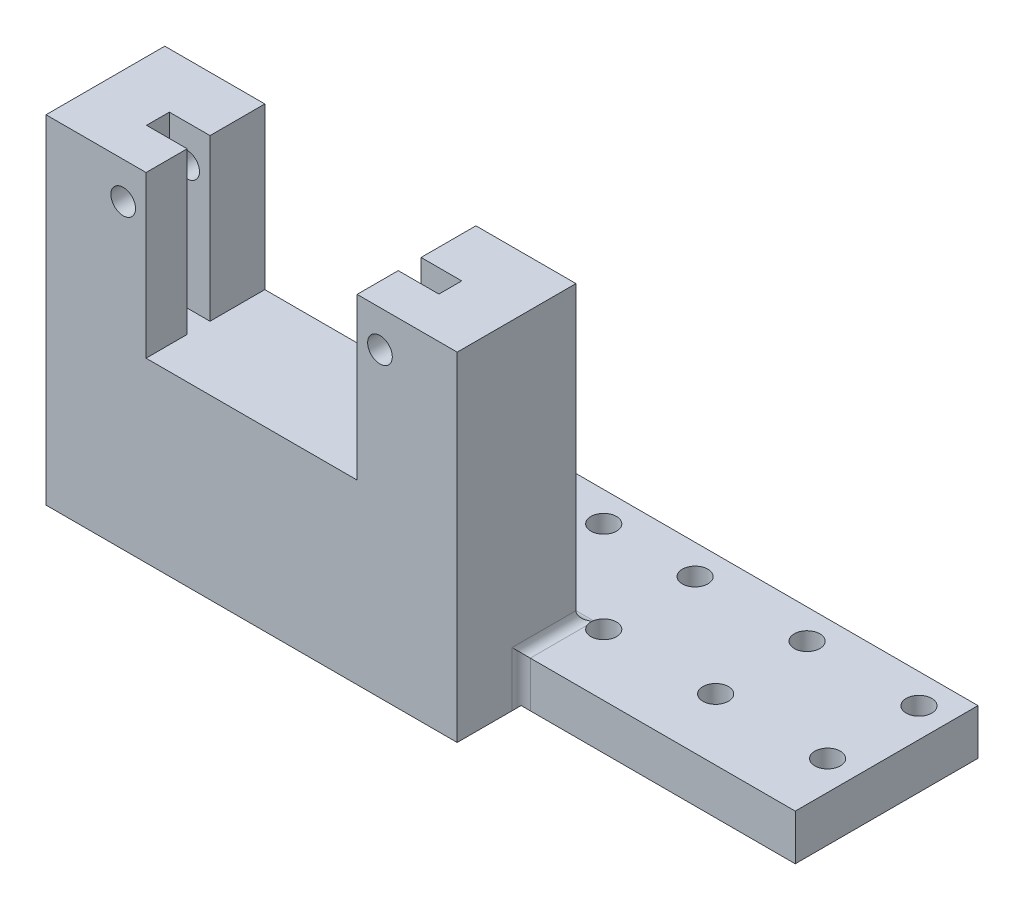
from build123d import *

# Parameters (mm, degrees)
SKETCH1_W           = 45
SKETCH1_H           = 6
BOSS_EXTRUDE1_DEPTH = 32
SKETCH2_W           = 23.1
SKETCH2_H           = 17.6
CUT_EXTRUDE1_DEPTH  = 56.542776308
SKETCH3_W           = 45
SKETCH3_H           = 20
BOSS_EXTRUDE2_DEPTH = 6
SKETCH4_W           = 20
SKETCH4_H           = 6
BOSS_EXTRUDE3_DEPTH = 30
SKETCH5_R           = 1.4
CUT_EXTRUDE2_DEPTH  = 87.423376467
BOSS_EXTRUDE4_DEPTH = 7
SKETCH7_W           = 32
SKETCH7_H           = 2.5
CUT_EXTRUDE3_DEPTH  = 17.6
SKETCH8_R           = 1.35
CUT_EXTRUDE4_DEPTH  = 86.895285086
CHAMFER1_SIZE       = 1
FILLET1_R           = 1


with BuildPart() as part:
    # Sketch1 → Boss-Extrude1 (new body)
    with BuildSketch(Plane(origin=(0, 0, 0), x_dir=(1, 0, 0), z_dir=(0, 1, 0))):
        with Locations((22.5, 3)):
            Rectangle(SKETCH1_W, SKETCH1_H)
    extrude(amount=BOSS_EXTRUDE1_DEPTH)

    # Sketch2 → Cut-Extrude1 (cut, through all)
    with BuildSketch(Plane.XY):
        with Locations((22.5, 23.2)):
            Rectangle(SKETCH2_W, SKETCH2_H)
    extrude(amount=-CUT_EXTRUDE1_DEPTH, mode=Mode.SUBTRACT)

    # Sketch3 → Boss-Extrude2 (add)
    with BuildSketch(Plane.XZ):
        with Locations((22.5, -10)):
            Rectangle(SKETCH3_W, SKETCH3_H)
    extrude(amount=BOSS_EXTRUDE2_DEPTH)

    # Sketch4 → Boss-Extrude3 (add)
    with BuildSketch(Plane(origin=(45, 0, 0), x_dir=(0, 0, -1), z_dir=(1, 0, 0))):
        with Locations((10, -3)):
            Rectangle(SKETCH4_W, SKETCH4_H)
    extrude(amount=BOSS_EXTRUDE3_DEPTH)

    # Sketch5 → Cut-Extrude2 (cut, through all)
    with BuildSketch(Plane.XZ.offset(6)):
        with Locations(Location((37.288839919, -16.75, 0), (0, 0, 270))):
            Circle(SKETCH5_R)
        with Locations(Location((47.288839919, -16.75, 0), (0, 0, 270))):
            Circle(SKETCH5_R)
        with Locations(Location((47.288839919, -6.75, 0), (0, 0, 270))):
            Circle(SKETCH5_R)
        with Locations(Location((59.538839919, -16.75, 0), (0, 0, 270))):
            Circle(SKETCH5_R)
        with Locations(Location((71.788839919, -16.75, 0), (0, 0, 270))):
            Circle(SKETCH5_R)
        with Locations(Location((71.788839919, -6.75, 0), (0, 0, 270))):
            Circle(SKETCH5_R)
        with Locations(Location((59.538839919, -6.75, 0), (0, 0, 270))):
            Circle(SKETCH5_R)
    extrude(amount=-CUT_EXTRUDE2_DEPTH, mode=Mode.SUBTRACT)

    # Sketch6 → Boss-Extrude4 (add)
    with BuildSketch(Plane.XY):
        Polygon((0, 32), (0, -6), (45, -6), (45, 0), (45, 32), (34.05, 32), (34.05, 14.4), (10.95, 14.4), (10.95, 32), align=None)
    extrude(amount=BOSS_EXTRUDE4_DEPTH)

    # Sketch7 → Cut-Extrude3 (cut)
    with BuildSketch(Plane(origin=(0, 32, 0), x_dir=(1, 0, 0), z_dir=(0, 1, 0))):
        with Locations((22.5, -1.25)):
            Rectangle(SKETCH7_W, SKETCH7_H)
    extrude(amount=-CUT_EXTRUDE3_DEPTH, mode=Mode.SUBTRACT)

    # Sketch8 → Cut-Extrude4 (cut, through all)
    with BuildSketch(Plane.XY.offset(7)):
        with Locations((8.45, 28)):
            Circle(SKETCH8_R)
        with Locations((36.55, 28)):
            Circle(SKETCH8_R)
    extrude(amount=-CUT_EXTRUDE4_DEPTH, mode=Mode.SUBTRACT)

    # Chamfer1
    chamfer1_edges = [part.edges().sort_by_distance(p)[0] for p in [
        (22.5, -6, 7),
        (0, -6, -6.5),
        (37.5, -6, -20),
        (60, -6, 0),
        (75, -6, -10),
        (45, -6, 3.5),
    ]]
    chamfer(chamfer1_edges, length=CHAMFER1_SIZE)

    # Fillet1
    # the kernel refuses this fillet: 1 mm, written as the material it adds along each edge
    with BuildSketch(Plane(origin=(45, 0, -6), x_dir=(0, 1, 0), z_dir=(0, 0, 1))) as fillet1_piece_1:
        with BuildLine():
            CenterArc((FILLET1_R, -FILLET1_R), FILLET1_R, 90, 90)
            Line((0, -FILLET1_R), (0, 0))
            Line((0, 0), (FILLET1_R, 0))
        make_face()
    extrude(amount=6)
    with BuildSketch(Plane(origin=(45, 0, -6), x_dir=(0, 0, -1), z_dir=(-1, 0, 0))) as fillet1_piece_2:
        with BuildLine():
            CenterArc((FILLET1_R, -FILLET1_R), FILLET1_R, 90, 90)
            Line((0, -FILLET1_R), (0, 0))
            Line((0, 0), (FILLET1_R, 0))
        make_face()
    extrude(amount=45)
    with BuildSketch(Plane(origin=(45, -7.5, 0), x_dir=(1, 0, 0), z_dir=(0, 1, 0))) as fillet1_piece_3_section:
        with BuildLine():
            CenterArc((FILLET1_R, -FILLET1_R), FILLET1_R, 90, 90)
            Line((0, -FILLET1_R), (0, 0))
            Line((0, 0), (FILLET1_R, 0))
        make_face()
    fillet1_piece_3 = extrude(amount=7.5, mode=Mode.PRIVATE)
    fillet1_piece_3 = split(fillet1_piece_3, bisect_by=Plane(origin=(45.042981958, -4.592558865, 0.407441135), z_dir=(0, -0.7071067811865476, 0.7071067811865476)), keep=Keep.TOP, mode=Mode.PRIVATE)
    fillet1_piece_3 = split(fillet1_piece_3, bisect_by=Plane(origin=(45.16446835, -4.83553165, 0.528927527), z_dir=(-0.7071067811865476, 0.7071067811865476, 0)), keep=Keep.TOP, mode=Mode.PRIVATE)
    add(fillet1_piece_3)
    with BuildSketch(Plane(origin=(45, -7.5, 0), x_dir=(1, 0, 0), z_dir=(0, 1, 0))) as fillet1_piece_4_section:
        with BuildLine():
            CenterArc((FILLET1_R, -FILLET1_R), FILLET1_R, 90, 90)
            Line((0, -FILLET1_R), (0, 0))
            Line((0, 0), (FILLET1_R, 0))
        make_face()
    fillet1_piece_4 = extrude(amount=7.5, mode=Mode.PRIVATE)
    fillet1_piece_4 = split(fillet1_piece_4, bisect_by=Plane(origin=(45.528927527, -4.83553165, 0.16446835), z_dir=(0, 0.7071067811865476, -0.7071067811865476)), keep=Keep.TOP, mode=Mode.PRIVATE)
    fillet1_piece_4 = split(fillet1_piece_4, bisect_by=Plane(origin=(45.407441135, -4.592558865, 0.042981958), z_dir=(0.7071067811865476, -0.7071067811865476, 0)), keep=Keep.TOP, mode=Mode.PRIVATE)
    add(fillet1_piece_4)
    with BuildSketch(Plane(origin=(45, -7.5, 0), x_dir=(1, 0, 0), z_dir=(0, 1, 0))) as fillet1_piece_5_section:
        with BuildLine():
            CenterArc((FILLET1_R, -FILLET1_R), FILLET1_R, 90, 90)
            Line((0, -FILLET1_R), (0, 0))
            Line((0, 0), (FILLET1_R, 0))
        make_face()
    fillet1_piece_5 = extrude(amount=7.5, mode=Mode.PRIVATE)
    fillet1_piece_5 = split(fillet1_piece_5, bisect_by=Plane(origin=(45.222376568, -3.546419499, 1.453580501), z_dir=(0, 0.7071067811865476, -0.7071067811865476)), keep=Keep.TOP, mode=Mode.PRIVATE)
    fillet1_piece_5 = split(fillet1_piece_5, bisect_by=Plane(origin=(46.453580501, -3.546419499, 0.222376568), z_dir=(-0.7071067811865476, 0.7071067811865476, 0)), keep=Keep.TOP, mode=Mode.PRIVATE)
    add(fillet1_piece_5)
    with BuildSketch(Plane(origin=(45, 0, -8.5), x_dir=(0, 1, 0), z_dir=(0, 0, 1))) as fillet1_piece_6a_section:
        with BuildLine():
            CenterArc((FILLET1_R, -FILLET1_R), FILLET1_R, 90, 90)
            Line((0, -FILLET1_R), (0, 0))
            Line((0, 0), (FILLET1_R, 0))
        make_face()
    fillet1_piece_6a = extrude(amount=8.5, mode=Mode.PRIVATE)
    fillet1_piece_6a = split(fillet1_piece_6a, bisect_by=Plane(origin=(45.224393795, 0.227043758, -6), z_dir=(0, 0, -1)), keep=Keep.TOP, mode=Mode.PRIVATE)
    fillet1_piece_6a = fillet1_piece_6a - Plane(origin=(47.288839919, 0.227043758, -6.75), x_dir=(0, 0, -1), z_dir=(0, -1, 0)) * Cylinder(1.4, 21, mode=Mode.PRIVATE)
    with BuildSketch(Plane(origin=(47.5, 0, -6), x_dir=(0, 0, -1), z_dir=(-1, 0, 0))) as fillet1_piece_6b_section:
        with BuildLine():
            CenterArc((FILLET1_R, -FILLET1_R), FILLET1_R, 90, 90)
            Line((0, -FILLET1_R), (0, 0))
            Line((0, 0), (FILLET1_R, 0))
        make_face()
    fillet1_piece_6b = extrude(amount=47.5, mode=Mode.PRIVATE)
    fillet1_piece_6b = split(fillet1_piece_6b, bisect_by=Plane(origin=(45, 0.236066937, -6.212082633), z_dir=(1, 0, 0)), keep=Keep.TOP, mode=Mode.PRIVATE)
    fillet1_piece_6b = fillet1_piece_6b - Plane(origin=(47.288839919, 0.236066937, -6.75), x_dir=(0, 0, -1), z_dir=(0, -1, 0)) * Cylinder(1.4, 99, mode=Mode.PRIVATE)
    fillet1_piece_6 = fillet1_piece_6a & fillet1_piece_6b
    add(fillet1_piece_6)
    with BuildSketch(Plane(origin=(45, -7.5, 0), x_dir=(1, 0, 0), z_dir=(0, 1, 0))) as fillet1_piece_7a_section:
        with BuildLine():
            CenterArc((FILLET1_R, -FILLET1_R), FILLET1_R, 90, 90)
            Line((0, -FILLET1_R), (0, 0))
            Line((0, 0), (FILLET1_R, 0))
        make_face()
    fillet1_piece_7a = extrude(amount=10, mode=Mode.PRIVATE)
    fillet1_piece_7a = split(fillet1_piece_7a, bisect_by=Plane(origin=(45.226395114, 0, 0.226395114), z_dir=(0, 1, 0)), keep=Keep.TOP, mode=Mode.PRIVATE)
    with BuildSketch(Plane(origin=(45, 0, -6), x_dir=(0, 1, 0), z_dir=(0, 0, 1))) as fillet1_piece_7b_section:
        with BuildLine():
            CenterArc((FILLET1_R, -FILLET1_R), FILLET1_R, 90, 90)
            Line((0, -FILLET1_R), (0, 0))
            Line((0, 0), (FILLET1_R, 0))
        make_face()
    fillet1_piece_7b = extrude(amount=8.5, mode=Mode.PRIVATE)
    fillet1_piece_7b = split(fillet1_piece_7b, bisect_by=Plane(origin=(45.226395114, 0.226395114, 0), z_dir=(0, 0, 1)), keep=Keep.TOP, mode=Mode.PRIVATE)
    fillet1_piece_7 = fillet1_piece_7a & fillet1_piece_7b
    add(fillet1_piece_7)


solid = part.part
